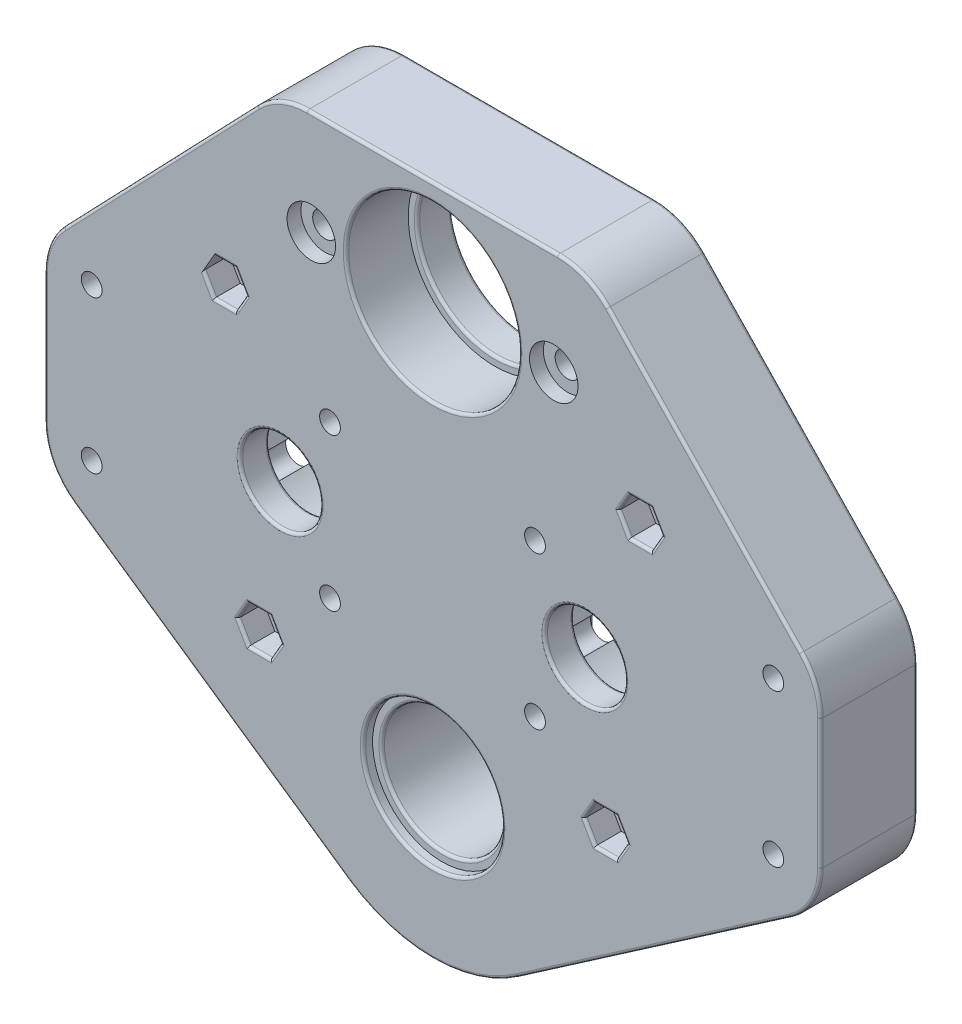
from build123d import *

# Parameters (mm, degrees)
SKETCH1_R                                 = 11.1125
SKETCH1_R_2                               = 7.366
SKETCH1_R_3                               = 14.2875
MAIN_BODY_DEPTH                           = 17.78
MOTOR_CAVITY_OUTLINE_R                    = 7.366
MOTOR_CAVITY_OUTLINE_R_2                  = 1.143
MOTOR_CAVITY_OUTLINE_R_3                  = 4.445
MOTOR_CAVITY_DEPTH                        = 12.446
MOTOR_CAVITY_2_OUTLINE_R                  = 1.143
MOTOR_CAVITY_2_OUTLINE_R_2                = 4.445
MOTOR_CAVITY_2_DEPTH                      = 2.286
MOTOR_START                               = 12.446
MOTOR_CAVITY_3_OUTLINE_R                  = 1.143
MOTOR_CAVITY_3_OUTLINE_R_2                = 4.445
MOTOR_CAVITY_3_DEPTH                      = 3.048
MOTOR_START_2                             = 14.478
MOTOR_CAVITY_4_OUTLINE_R                  = 1.905
MOTOR_CAVITY_4_DEPTH                      = 3.302
MOTOR_START_3                             = 2.286
MOTOR_CAVITY_5_DEPTH                      = 1.778
MOTOR_CAVITY_6_OUTLINE_R                  = 2.286
MOTOR_CAVITY_6_DEPTH                      = 1.27
MOTOR_START_4                             = 15.494
MOTOR_CAVITY_7_DEPTH                      = 0.254
FILLET2_R                                 = 12.7
SKETCH10_R                                = 12.7635
HS_AXLE_BEARING_FLANGE_DEPTH              = 1.778
SKETCH11_R                                = 15.875
BALL_SHIFTER_BEARING_FLANGE_DEPTH         = 11.43
BEARING_FILLET_R                          = 0.508
SKETCH14_R                                = 2.286
GEARBOX_CONNECTION_HOLES_DEPTH            = 133.703818668
POST_HEX_DEPTH                            = 4.826
SKETCH16_R                                = 4.445
GEARBOX_CONNECTION_BOLT_COUNTERBORE_DEPTH = 2.54
SKETCH17_R                                = 2.286
PISTON_MOUNT_HOLES_DEPTH                  = 133.703818668
SKETCH18_R                                = 4.445
PISTON_MOUNT_BOLT_COUNTERBORE_DEPTH       = 2.54
CUT_EXTRUDE2_DEPTH                        = 7.14502
SKETCH21_W                                = 56.72351851
SKETCH21_H                                = 14.605
CUT_EXTRUDE1_DEPTH                        = 133.703818668
FILLET4_R                                 = 0.508
FILLET5_R                                 = 12.7


# Read off the part's stored shape, not the designer's step: Motor Cavity
with BuildPart() as part:
    # Sketch1 → Main Body (new body)
    with BuildSketch(Plane.XY):
        with BuildLine():
            Line((-15.500729017, -22.478665996), (-71.12, 15.875))
            Line((-71.12, 15.875), (-71.12, 51.435))
            Line((-71.12, 51.435), (-24.288000098, 100.259040074))
            ThreePointArc((-24.288000098, 100.259040074), (0, 110.617), (24.288000098, 100.259040074))
            Line((24.288000098, 100.259040074), (71.12, 51.435))
            Line((71.12, 51.435), (71.12, 15.875))
            Line((71.12, 15.875), (15.500729017, -22.478665996))
            ThreePointArc((15.500729017, -22.478665996), (0, -27.305), (-15.500729017, -22.478665996))
        make_face()
        Circle(SKETCH1_R, mode=Mode.SUBTRACT)
        with Locations((-27.94, 34.571070276)):
            Circle(SKETCH1_R_2, mode=Mode.SUBTRACT)
        with Locations(Location((27.94, 34.571070276, 0), (0, 0, 180))):
            Circle(SKETCH1_R_2, mode=Mode.SUBTRACT)
        with Locations((0, 76.962)):
            Circle(SKETCH1_R_3, mode=Mode.SUBTRACT)
    extrude(amount=MAIN_BODY_DEPTH)

    # Motor Cavity outline → Motor Cavity (cut)
    # profile 1 of 12: a face of its own
    with BuildSketch(Plane.XY):
        with BuildLine():
            ThreePointArc((15.229811482, 41.234576022), (13.589, 34.571070275), (15.229811482, 27.907564529))
            ThreePointArc((15.229811482, 27.907564529), (13.900894786, 24.334222724), (17.709432496, 24.506941423))
            ThreePointArc((17.709432496, 24.506941423), (27.94, 20.220070276), (38.170567504, 24.506941423))
            ThreePointArc((38.170567504, 24.506941423), (41.979105214, 24.334222724), (40.650188518, 27.907564529))
            ThreePointArc((40.650188518, 27.907564529), (42.291, 34.571070275), (40.650188518, 41.234576022))
            ThreePointArc((40.650188518, 41.234576022), (41.979105214, 44.807917828), (38.170567504, 44.635199128))
            ThreePointArc((38.170567504, 44.635199128), (27.94, 48.922070276), (17.709432496, 44.635199128))
            ThreePointArc((17.709432496, 44.635199128), (13.900894786, 44.807917828), (15.229811482, 41.234576022))
        make_face()
        with Locations((27.94, 34.571070276)):
            Circle(MOTOR_CAVITY_OUTLINE_R, mode=Mode.SUBTRACT)
    # profile 2 of 12: a face of its own
    with BuildSketch(Plane.XY):
        with Locations((18.796, 48.541070276)):
            Circle(MOTOR_CAVITY_OUTLINE_R_2)
    # profile 3 of 12: a face of its own
    with BuildSketch(Plane.XY):
        with Locations((62.484, 48.541070276)):
            Circle(MOTOR_CAVITY_OUTLINE_R_2)
    # profile 4 of 12: a face of its own
    with BuildSketch(Plane.XY):
        with Locations((18.796, 20.601070276)):
            Circle(MOTOR_CAVITY_OUTLINE_R_2)
    # profile 5 of 12: a face of its own
    with BuildSketch(Plane.XY):
        with BuildLine():
            ThreePointArc((-15.229811482, 27.907564529), (-13.589, 34.571070275), (-15.229811482, 41.234576022))
            ThreePointArc((-15.229811482, 41.234576022), (-13.900894786, 44.807917828), (-17.709432496, 44.635199128))
            ThreePointArc((-17.709432496, 44.635199128), (-27.94, 48.922070276), (-38.170567504, 44.635199128))
            ThreePointArc((-38.170567504, 44.635199128), (-41.979105214, 44.807917828), (-40.650188518, 41.234576023))
            ThreePointArc((-40.650188518, 41.234576023), (-42.291, 34.571070275), (-40.650188518, 27.907564529))
            ThreePointArc((-40.650188518, 27.907564529), (-41.979105214, 24.334222724), (-38.170567504, 24.506941423))
            ThreePointArc((-38.170567504, 24.506941423), (-27.94, 20.220070276), (-17.709432496, 24.506941423))
            ThreePointArc((-17.709432496, 24.506941423), (-13.900894786, 24.334222724), (-15.229811482, 27.907564529))
        make_face()
        with Locations((-27.94, 34.571070276)):
            Circle(MOTOR_CAVITY_OUTLINE_R, mode=Mode.SUBTRACT)
    # profile 6 of 12: a face of its own
    with BuildSketch(Plane.XY):
        with Locations((53.34, 34.571070276)):
            Circle(MOTOR_CAVITY_OUTLINE_R_3)
    # profile 7 of 12: a face of its own
    with BuildSketch(Plane.XY):
        with Locations((-18.796, 48.541070276)):
            Circle(MOTOR_CAVITY_OUTLINE_R_2)
    # profile 8 of 12: a face of its own
    with BuildSketch(Plane.XY):
        with Locations((-18.796, 20.601070276)):
            Circle(MOTOR_CAVITY_OUTLINE_R_2)
    # profile 9 of 12: a face of its own
    with BuildSketch(Plane.XY):
        with Locations((62.484, 20.601070276)):
            Circle(MOTOR_CAVITY_OUTLINE_R_2)
    # profile 10 of 12: a face of its own
    with BuildSketch(Plane.XY):
        with Locations((-62.484, 48.541070276)):
            Circle(MOTOR_CAVITY_OUTLINE_R_2)
    # profile 11 of 12: a face of its own
    with BuildSketch(Plane.XY):
        with Locations((-62.484, 20.601070276)):
            Circle(MOTOR_CAVITY_OUTLINE_R_2)
    # profile 12 of 12: a face of its own
    with BuildSketch(Plane.XY):
        with Locations((-53.34, 34.571070276)):
            Circle(MOTOR_CAVITY_OUTLINE_R_3)
    extrude(amount=MOTOR_CAVITY_DEPTH, mode=Mode.SUBTRACT)

    # Motor Cavity 2 outline → Motor Cavity 2 (cut)
    # profile 1 of 2: a face of its own
    with BuildSketch(Plane.XY):
        with BuildLine():
            ThreePointArc((14.986, 51.398570276), (12.471528286, 50.35704199), (11.43, 47.842570276))
            Line((11.43, 47.842570276), (11.43, 21.299570276))
            ThreePointArc((11.43, 21.299570276), (12.471528286, 18.785098562), (14.986, 17.743570276))
            Line((14.986, 17.743570276), (66.294, 17.743570276))
            ThreePointArc((66.294, 17.743570276), (68.808471714, 18.785098562), (69.85, 21.299570276))
            Line((69.85, 21.299570276), (69.85, 47.842570276))
            ThreePointArc((69.85, 47.842570276), (68.808471713, 50.35704199), (66.294, 51.398570276))
            Line((66.294, 51.398570276), (14.986, 51.398570276))
        make_face()
        with BuildLine():
            ThreePointArc((17.709432496, 44.635199128), (27.94, 48.922070276), (38.170567504, 44.635199128))
            ThreePointArc((38.170567504, 44.635199128), (41.979105214, 44.807917828), (40.650188518, 41.234576023))
            ThreePointArc((40.650188518, 41.234576023), (42.291, 34.571070275), (40.650188518, 27.907564529))
            ThreePointArc((40.650188518, 27.907564529), (41.979105214, 24.334222724), (38.170567504, 24.506941423))
            ThreePointArc((38.170567504, 24.506941423), (27.94, 20.220070276), (17.709432496, 24.506941423))
            ThreePointArc((17.709432496, 24.506941423), (13.900894786, 24.334222724), (15.229811482, 27.907564529))
            ThreePointArc((15.229811482, 27.907564529), (13.589, 34.571070275), (15.229811482, 41.234576022))
            ThreePointArc((15.229811482, 41.234576022), (13.900894786, 44.807917828), (17.709432496, 44.635199128))
        make_face(mode=Mode.SUBTRACT)
        with Locations((18.796, 48.541070276)):
            Circle(MOTOR_CAVITY_2_OUTLINE_R, mode=Mode.SUBTRACT)
        with Locations((62.484, 48.541070276)):
            Circle(MOTOR_CAVITY_2_OUTLINE_R, mode=Mode.SUBTRACT)
        with Locations((53.34, 34.571070276)):
            Circle(MOTOR_CAVITY_2_OUTLINE_R_2, mode=Mode.SUBTRACT)
        with Locations((18.796, 20.601070276)):
            Circle(MOTOR_CAVITY_2_OUTLINE_R, mode=Mode.SUBTRACT)
        with Locations((62.484, 20.601070276)):
            Circle(MOTOR_CAVITY_2_OUTLINE_R, mode=Mode.SUBTRACT)
    # profile 2 of 2: a face of its own
    with BuildSketch(Plane.XY):
        with BuildLine():
            ThreePointArc((-11.43, 47.842570276), (-12.471528286, 50.357041989), (-14.986, 51.398570276))
            Line((-14.986, 51.398570276), (-66.294, 51.398570276))
            ThreePointArc((-66.294, 51.398570276), (-68.808471713, 50.35704199), (-69.85, 47.842570276))
            Line((-69.85, 47.842570276), (-69.85, 21.299570276))
            ThreePointArc((-69.85, 21.299570276), (-68.808471714, 18.785098562), (-66.294, 17.743570276))
            Line((-66.294, 17.743570276), (-14.986, 17.743570276))
            ThreePointArc((-14.986, 17.743570276), (-12.471528286, 18.785098562), (-11.43, 21.299570276))
            Line((-11.43, 21.299570276), (-11.43, 47.842570276))
        make_face()
        with BuildLine():
            ThreePointArc((-15.229811482, 27.907564529), (-13.900894786, 24.334222724), (-17.709432496, 24.506941423))
            ThreePointArc((-17.709432496, 24.506941423), (-27.94, 20.220070276), (-38.170567504, 24.506941423))
            ThreePointArc((-38.170567504, 24.506941423), (-41.979105214, 24.334222724), (-40.650188518, 27.907564529))
            ThreePointArc((-40.650188518, 27.907564529), (-42.291, 34.571070275), (-40.650188518, 41.234576022))
            ThreePointArc((-40.650188518, 41.234576022), (-41.979105214, 44.807917828), (-38.170567504, 44.635199128))
            ThreePointArc((-38.170567504, 44.635199128), (-27.94, 48.922070276), (-17.709432496, 44.635199128))
            ThreePointArc((-17.709432496, 44.635199128), (-13.900894786, 44.807917828), (-15.229811482, 41.234576023))
            ThreePointArc((-15.229811482, 41.234576023), (-13.589, 34.571070275), (-15.229811482, 27.907564529))
        make_face(mode=Mode.SUBTRACT)
        with Locations((-18.796, 20.601070276)):
            Circle(MOTOR_CAVITY_2_OUTLINE_R, mode=Mode.SUBTRACT)
        with Locations((-18.796, 48.541070276)):
            Circle(MOTOR_CAVITY_2_OUTLINE_R, mode=Mode.SUBTRACT)
        with Locations((-62.484, 20.601070276)):
            Circle(MOTOR_CAVITY_2_OUTLINE_R, mode=Mode.SUBTRACT)
        with Locations((-53.34, 34.571070276)):
            Circle(MOTOR_CAVITY_2_OUTLINE_R_2, mode=Mode.SUBTRACT)
        with Locations((-62.484, 48.541070276)):
            Circle(MOTOR_CAVITY_2_OUTLINE_R, mode=Mode.SUBTRACT)
    extrude(amount=MOTOR_CAVITY_2_DEPTH, mode=Mode.SUBTRACT)

    # Motor Cavity 3 outline → Motor Cavity 3 (cut)
    with BuildSketch(Plane.XY.offset(MOTOR_START)):
        with Locations((18.796, 48.541070276)):
            Circle(MOTOR_CAVITY_3_OUTLINE_R)
        with Locations((62.484, 48.541070276)):
            Circle(MOTOR_CAVITY_3_OUTLINE_R)
        with BuildLine():
            ThreePointArc((41.826815, 30.950632435), (42.291, 34.571070275), (41.826815, 38.191508116))
            ThreePointArc((41.826815, 38.191508116), (36.83, 34.571070275), (41.826815, 30.950632435))
        make_face()
        with Locations((18.796, 20.601070276)):
            Circle(MOTOR_CAVITY_3_OUTLINE_R)
        with Locations((53.34, 34.571070276)):
            Circle(MOTOR_CAVITY_3_OUTLINE_R_2)
        with Locations((-18.796, 48.541070276)):
            Circle(MOTOR_CAVITY_3_OUTLINE_R)
        with Locations((-18.796, 20.601070276)):
            Circle(MOTOR_CAVITY_3_OUTLINE_R)
        with Locations((62.484, 20.601070276)):
            Circle(MOTOR_CAVITY_3_OUTLINE_R)
        with Locations((-62.484, 48.541070276)):
            Circle(MOTOR_CAVITY_3_OUTLINE_R)
        with Locations((-62.484, 20.601070276)):
            Circle(MOTOR_CAVITY_3_OUTLINE_R)
        with BuildLine():
            ThreePointArc((-41.826815, 30.950632435), (-36.83, 34.571070275), (-41.826815, 38.191508116))
            ThreePointArc((-41.826815, 38.191508116), (-42.291, 34.571070275), (-41.826815, 30.950632435))
        make_face()
        with Locations((-53.34, 34.571070276)):
            Circle(MOTOR_CAVITY_3_OUTLINE_R_2)
    extrude(amount=MOTOR_CAVITY_3_DEPTH, mode=Mode.SUBTRACT)

    # Motor Cavity 4 outline → Motor Cavity 4 (cut)
    with BuildSketch(Plane.XY.offset(MOTOR_START_2)):
        with Locations((18.796, 48.541070276)):
            Circle(MOTOR_CAVITY_4_OUTLINE_R)
        with Locations((62.484, 48.541070276)):
            Circle(MOTOR_CAVITY_4_OUTLINE_R)
        with Locations((18.796, 20.601070276)):
            Circle(MOTOR_CAVITY_4_OUTLINE_R)
        with Locations((-18.796, 48.541070276)):
            Circle(MOTOR_CAVITY_4_OUTLINE_R)
        with Locations((-18.796, 20.601070276)):
            Circle(MOTOR_CAVITY_4_OUTLINE_R)
        with Locations((62.484, 20.601070276)):
            Circle(MOTOR_CAVITY_4_OUTLINE_R)
        with Locations((-62.484, 48.541070276)):
            Circle(MOTOR_CAVITY_4_OUTLINE_R)
        with Locations((-62.484, 20.601070276)):
            Circle(MOTOR_CAVITY_4_OUTLINE_R)
    extrude(amount=MOTOR_CAVITY_4_DEPTH, mode=Mode.SUBTRACT)

    # Motor Cavity 5 outline → Motor Cavity 5 (cut)
    with BuildSketch(Plane.XY.offset(MOTOR_START_3)):
        with BuildLine():
            Line((52.329058675, 38.899583027), (54.238725974, 40.840832041))
            ThreePointArc((54.238725974, 40.840832041), (50.847666793, 39.152113898), (49.021648336, 35.832971248))
            Line((49.021648336, 35.832971248), (49.072941907, 35.816156713))
            ThreePointArc((49.072941907, 35.816156713), (50.283662499, 37.798581094), (52.329058675, 38.899583027))
        make_face()
        with BuildLine():
            ThreePointArc((61.007669642, 37.238304535), (58.228349782, 40.176614324), (54.238725974, 40.840832041))
            Line((54.238725974, 40.840832041), (52.329058675, 38.899583027))
            ThreePointArc((52.329058675, 38.899583027), (55.454880605, 38.480712846), (57.516068943, 36.093723613))
            Line((57.516068943, 36.093723613), (61.007669642, 37.238304535))
        make_face()
        with BuildLine():
            ThreePointArc((61.595, 34.571070276), (61.446429361, 35.936637516), (61.007669642, 37.238304535))
            Line((61.007669642, 37.238304535), (57.516068943, 36.093723613))
            ThreePointArc((57.516068943, 36.093723613), (57.717250932, 35.344180407), (57.785, 34.571070276))
            ThreePointArc((57.785, 34.571070276), (57.717250932, 33.797960145), (57.516068943, 33.048416938))
            Line((57.516068943, 33.048416938), (61.007669642, 31.903836016))
            ThreePointArc((61.007669642, 31.903836016), (61.44642936, 33.205503036), (61.595, 34.571070276))
        make_face()
        with BuildLine():
            Line((49.072941907, 35.816156713), (49.021648336, 35.832971248))
            ThreePointArc((49.021648336, 35.832971248), (48.988043509, 35.654119431), (48.959577581, 35.474378096))
            Line((48.959577581, 35.474378096), (48.995488935, 35.510883345))
            ThreePointArc((48.995488935, 35.510883345), (49.031510845, 35.664206225), (49.072941907, 35.816156713))
        make_face()
        with BuildLine():
            ThreePointArc((54.238725966, 28.301308513), (58.228349778, 28.965526226), (61.007669642, 31.903836016))
            Line((61.007669642, 31.903836016), (57.516068943, 33.048416938))
            ThreePointArc((57.516068943, 33.048416938), (55.454880601, 30.661427704), (52.329058668, 30.242557527))
            Line((52.329058668, 30.242557527), (54.238725966, 28.301308513))
        make_face()
        with BuildLine():
            Line((48.995488935, 35.510883345), (48.959577581, 35.474378096))
            ThreePointArc((48.959577581, 35.474378096), (48.911164971, 35.02387688), (48.895, 34.571070276))
            ThreePointArc((48.895, 34.571070276), (48.920193631, 35.043655356), (48.995488935, 35.510883345))
        make_face()
        with BuildLine():
            Line((48.995488936, 33.631257201), (48.959577582, 33.66776245))
            ThreePointArc((48.959577582, 33.66776245), (48.98804351, 33.488021117), (49.021648336, 33.309169303))
            Line((49.021648336, 33.309169303), (49.072941908, 33.325983838))
            ThreePointArc((49.072941908, 33.325983838), (49.031510846, 33.477934323), (48.995488936, 33.631257201))
        make_face()
        with BuildLine():
            ThreePointArc((48.895, 34.571070276), (48.911164971, 34.118263669), (48.959577582, 33.66776245))
            Line((48.959577582, 33.66776245), (48.995488936, 33.631257201))
            ThreePointArc((48.995488936, 33.631257201), (48.920193631, 34.098485193), (48.895, 34.571070276))
        make_face()
        with BuildLine():
            ThreePointArc((49.021648336, 33.309169303), (50.84766679, 29.990026656), (54.238725966, 28.301308513))
            Line((54.238725966, 28.301308513), (52.329058668, 30.242557527))
            ThreePointArc((52.329058668, 30.242557527), (50.283662496, 31.343559461), (49.072941908, 33.325983838))
            Line((49.072941908, 33.325983838), (49.021648336, 33.309169303))
        make_face()
        with BuildLine():
            Line((-52.329058675, 38.899583027), (-54.238725974, 40.840832041))
            ThreePointArc((-54.238725974, 40.840832041), (-58.228349782, 40.176614324), (-61.007669642, 37.238304535))
            Line((-61.007669642, 37.238304535), (-57.516068943, 36.093723613))
            ThreePointArc((-57.516068943, 36.093723613), (-55.454880605, 38.480712846), (-52.329058675, 38.899583027))
        make_face()
        with BuildLine():
            ThreePointArc((-49.021648336, 35.832971248), (-50.847666793, 39.152113898), (-54.238725974, 40.840832041))
            Line((-54.238725974, 40.840832041), (-52.329058675, 38.899583027))
            ThreePointArc((-52.329058675, 38.899583027), (-50.283662499, 37.798581094), (-49.072941907, 35.816156713))
            Line((-49.072941907, 35.816156713), (-49.021648336, 35.832971248))
        make_face()
        with BuildLine():
            ThreePointArc((-48.959577581, 35.474378096), (-48.988043509, 35.654119431), (-49.021648336, 35.832971248))
            Line((-49.021648336, 35.832971248), (-49.072941907, 35.816156713))
            ThreePointArc((-49.072941907, 35.816156713), (-49.031510845, 35.664206225), (-48.995488935, 35.510883345))
            Line((-48.995488935, 35.510883345), (-48.959577581, 35.474378096))
        make_face()
        with BuildLine():
            Line((-57.516068943, 36.093723613), (-61.007669642, 37.238304535))
            ThreePointArc((-61.007669642, 37.238304535), (-61.595, 34.571070276), (-61.007669642, 31.903836016))
            Line((-61.007669642, 31.903836016), (-57.516068943, 33.048416938))
            ThreePointArc((-57.516068943, 33.048416938), (-57.785, 34.571070276), (-57.516068943, 36.093723613))
        make_face()
        with BuildLine():
            Line((-52.329058668, 30.242557527), (-54.238725966, 28.301308513))
            ThreePointArc((-54.238725966, 28.301308513), (-50.84766679, 29.990026656), (-49.021648336, 33.309169303))
            Line((-49.021648336, 33.309169303), (-49.072941908, 33.325983838))
            ThreePointArc((-49.072941908, 33.325983838), (-50.283662496, 31.343559461), (-52.329058668, 30.242557527))
        make_face()
        with BuildLine():
            ThreePointArc((-61.007669642, 31.903836016), (-58.228349778, 28.965526226), (-54.238725966, 28.301308513))
            Line((-54.238725966, 28.301308513), (-52.329058668, 30.242557527))
            ThreePointArc((-52.329058668, 30.242557527), (-55.454880601, 30.661427704), (-57.516068943, 33.048416938))
            Line((-57.516068943, 33.048416938), (-61.007669642, 31.903836016))
        make_face()
        with BuildLine():
            Line((-49.072941908, 33.325983838), (-49.021648336, 33.309169303))
            ThreePointArc((-49.021648336, 33.309169303), (-48.98804351, 33.488021117), (-48.959577582, 33.66776245))
            Line((-48.959577582, 33.66776245), (-48.995488936, 33.631257201))
            ThreePointArc((-48.995488936, 33.631257201), (-49.031510846, 33.477934323), (-49.072941908, 33.325983838))
        make_face()
        with BuildLine():
            ThreePointArc((-48.895, 34.571070276), (-48.911164971, 35.02387688), (-48.959577581, 35.474378096))
            Line((-48.959577581, 35.474378096), (-48.995488935, 35.510883345))
            ThreePointArc((-48.995488935, 35.510883345), (-48.920193631, 35.043655356), (-48.895, 34.571070276))
        make_face()
        with BuildLine():
            Line((-48.995488936, 33.631257201), (-48.959577582, 33.66776245))
            ThreePointArc((-48.959577582, 33.66776245), (-48.911164971, 34.118263669), (-48.895, 34.571070276))
            ThreePointArc((-48.895, 34.571070276), (-48.920193631, 34.098485193), (-48.995488936, 33.631257201))
        make_face()
    extrude(amount=MOTOR_CAVITY_5_DEPTH, mode=Mode.SUBTRACT)

    # Motor Cavity 6 outline → Motor Cavity 6 (cut)
    with BuildSketch(Plane.XY.offset(MOTOR_START)):
        with Locations((15.748, 43.461070276)):
            Circle(MOTOR_CAVITY_6_OUTLINE_R)
        with Locations((40.132, 43.461070276)):
            Circle(MOTOR_CAVITY_6_OUTLINE_R)
        with Locations((15.748, 25.681070276)):
            Circle(MOTOR_CAVITY_6_OUTLINE_R)
        with Locations((40.132, 25.681070276)):
            Circle(MOTOR_CAVITY_6_OUTLINE_R)
        with Locations((-15.748, 25.681070276)):
            Circle(MOTOR_CAVITY_6_OUTLINE_R)
        with Locations((-15.748, 43.461070276)):
            Circle(MOTOR_CAVITY_6_OUTLINE_R)
        with Locations((-40.132, 43.461070276)):
            Circle(MOTOR_CAVITY_6_OUTLINE_R)
        with Locations((-40.132, 25.681070276)):
            Circle(MOTOR_CAVITY_6_OUTLINE_R)
    extrude(amount=MOTOR_CAVITY_6_DEPTH, mode=Mode.SUBTRACT)

    # Motor Cavity 7 outline → Motor Cavity 7 (cut)
    with BuildSketch(Plane.XY.offset(MOTOR_START_4)):
        with BuildLine():
            ThreePointArc((41.826815, 30.950632435), (42.291, 34.571070275), (41.826815, 38.191508116))
            ThreePointArc((41.826815, 38.191508116), (36.83, 34.571070275), (41.826815, 30.950632435))
        make_face()
        with BuildLine():
            ThreePointArc((-41.826815, 30.950632435), (-36.83, 34.571070275), (-41.826815, 38.191508116))
            ThreePointArc((-41.826815, 38.191508116), (-42.291, 34.571070275), (-41.826815, 30.950632435))
        make_face()
    extrude(amount=MOTOR_CAVITY_7_DEPTH, mode=Mode.SUBTRACT)

    # Fillet2
    fillet2_edges = [part.edges().sort_by_distance(p)[0] for p in [
        (-71.12, 15.875, 8.89),
        (-71.12, 51.435, 8.89),
        (71.12, 51.435, 8.89),
        (71.12, 15.875, 8.89),
    ]]
    fillet(fillet2_edges, radius=FILLET2_R)

    # Sketch10 → HS Axle Bearing Flange (cut)
    with BuildSketch(Plane.XY.offset(17.78)):
        Circle(SKETCH10_R)
    extrude(amount=-HS_AXLE_BEARING_FLANGE_DEPTH, mode=Mode.SUBTRACT)

    # Sketch11 → Ball Shifter Bearing Flange (cut)
    with BuildSketch(Plane.XY.offset(17.78)):
        with Locations((0, 76.962)):
            Circle(SKETCH11_R)
    extrude(amount=-BALL_SHIFTER_BEARING_FLANGE_DEPTH, mode=Mode.SUBTRACT)

    # Bearing Fillet
    bearing_fillet_edges = [part.edges().sort_by_distance(p)[0] for p in [
        (-11.1125, 0, 0),
        (-14.2875, 76.962, 0),
        (-11.1125, 0, 16.002),
        (-12.7635, 0, 17.78),
        (-15.875, 76.962, 17.78),
        (-14.2875, 76.962, 6.35),
    ]]
    fillet(bearing_fillet_edges, radius=BEARING_FILLET_R)

    # Sketch14 → Gearbox Connection Holes (cut, through all)
    with BuildSketch(Plane.XY.offset(17.78)):
        with Locations((-38.1, 60.96)):
            Circle(SKETCH14_R)
        with Locations((-31.75, 8.89)):
            Circle(SKETCH14_R)
        with Locations(Location((38.1, 60.96, 0), (0, 0, 180))):
            Circle(SKETCH14_R)
        with Locations(Location((31.75, 8.89, 0), (0, 0, 180))):
            Circle(SKETCH14_R)
    extrude(amount=-GEARBOX_CONNECTION_HOLES_DEPTH, mode=Mode.SUBTRACT)

    # Sketch15 → Post Hex (cut)
    with BuildSketch(Plane.XY.offset(17.78)):
        Polygon((-34.140531854, 60.96), (-36.120265927, 64.389), (-40.079734073, 64.389), (-42.059468146, 60.96), (-40.079734073, 57.531), (-36.120265927, 57.531), align=None)
        Polygon((-27.790531854, 8.89), (-29.770265927, 12.319), (-33.729734073, 12.319), (-35.709468146, 8.89), (-33.729734073, 5.461), (-29.770265927, 5.461), align=None)
        Polygon((29.770265927, 5.461), (27.790531854, 8.89), (29.770265927, 12.319), (33.729734073, 12.319), (35.709468146, 8.89), (33.729734073, 5.461), align=None)
        Polygon((36.120265927, 57.531), (34.140531854, 60.96), (36.120265927, 64.389), (40.079734073, 64.389), (42.059468146, 60.96), (40.079734073, 57.531), align=None)
    extrude(amount=-POST_HEX_DEPTH, mode=Mode.SUBTRACT)

    # Sketch16 → Gearbox Connection Bolt Counterbore (cut)
    with BuildSketch(Plane(origin=(0, 0, 0), x_dir=(-1, 0, 0), z_dir=(0, 0, -1))):
        with Locations((-38.1, 60.96)):
            Circle(SKETCH16_R)
        with Locations((-31.75, 8.89)):
            Circle(SKETCH16_R)
        with Locations((38.1, 60.96)):
            Circle(SKETCH16_R)
        with Locations((31.75, 8.89)):
            Circle(SKETCH16_R)
    extrude(amount=-GEARBOX_CONNECTION_BOLT_COUNTERBORE_DEPTH, mode=Mode.SUBTRACT)

    # Sketch17 → Piston Mount Holes (cut, through all)
    with BuildSketch(Plane.XY.offset(17.78)):
        with Locations((-22.225, 76.962)):
            Circle(SKETCH17_R)
        with Locations(Location((22.225, 76.962, 0), (0, 0, 180))):
            Circle(SKETCH17_R)
    extrude(amount=-PISTON_MOUNT_HOLES_DEPTH, mode=Mode.SUBTRACT)

    # Sketch18 → Piston Mount Bolt Counterbore (cut)
    with BuildSketch(Plane.XY.offset(17.78)):
        with Locations((-22.225, 76.962)):
            Circle(SKETCH18_R)
        with Locations((22.225, 76.962)):
            Circle(SKETCH18_R)
    extrude(amount=-PISTON_MOUNT_BOLT_COUNTERBORE_DEPTH, mode=Mode.SUBTRACT)

    # Sketch22 → Cut-Extrude2 (cut)
    with BuildSketch(Plane(origin=(0, 0, 0), x_dir=(-1, 0, 0), z_dir=(0, 0, -1))):
        Polygon((-18.265531854, 76.962), (-20.245265927, 80.391), (-24.204734073, 80.391), (-26.184468146, 76.962), (-24.204734073, 73.533), (-20.245265927, 73.533), align=None)
        Polygon((26.184468146, 76.962), (24.204734073, 80.391), (20.245265927, 80.391), (18.265531854, 76.962), (20.245265927, 73.533), (24.204734073, 73.533), align=None)
    extrude(amount=-CUT_EXTRUDE2_DEPTH, mode=Mode.SUBTRACT)

    # Sketch21 → Cut-Extrude1 (cut, through all)
    with BuildSketch(Plane(origin=(0, 0, 0), x_dir=(-1, 0, 0), z_dir=(0, 0, -1))):
        with Locations((0, 103.3145)):
            Rectangle(SKETCH21_W, SKETCH21_H)
    extrude(amount=-CUT_EXTRUDE1_DEPTH, mode=Mode.SUBTRACT)

    # Fillet4
    fillet4_edges = [part.edges().sort_by_distance(p)[0] for p in [
        (40.56518521, -5.194840368, 0),
        (0, -27.305, 0),
        (-35.306, 34.571070276, 12.446),
        (-35.306, 34.571070276, 17.78),
        (35.306, 34.571070276, 17.78),
        (47.973521156, 75.566034614, 0),
        (47.973521156, 75.566034614, 17.78),
        (-40.56518521, -5.194840368, 0),
        (-71.12, 34.436456048, 0),
        (71.12, 34.436456048, 0),
        (-70.20323162, 51.066396551, 0),
        (-69.663941609, 16.639623124, 0),
        (69.663941609, 16.639623124, 0),
        (70.20323162, 51.066396551, 0),
        (71.12, 34.436456048, 17.78),
        (-71.12, 34.436456048, 17.78),
        (-40.56518521, -5.194840368, 17.78),
        (-70.20323162, 51.066396551, 17.78),
        (-69.663941609, 16.639623124, 17.78),
        (69.663941609, 16.639623124, 17.78),
        (70.20323162, 51.066396551, 17.78),
        (0, -27.305, 17.78),
        (40.386, 60.96, 12.954),
        (38.1, 57.531, 17.78),
        (41.06960111, 59.2455, 17.78),
        (41.06960111, 62.6745, 17.78),
        (38.1, 64.389, 17.78),
        (35.13039889, 62.6745, 17.78),
        (35.13039889, 59.2455, 17.78),
        (34.036, 8.89, 12.954),
        (31.75, 5.461, 17.78),
        (34.71960111, 7.1755, 17.78),
        (34.71960111, 10.6045, 17.78),
        (31.75, 12.319, 17.78),
        (28.78039889, 10.6045, 17.78),
        (28.78039889, 7.1755, 17.78),
        (-28.78039889, 7.1755, 17.78),
        (-28.78039889, 10.6045, 17.78),
        (-31.75, 12.319, 17.78),
        (-34.71960111, 10.6045, 17.78),
        (-34.71960111, 7.1755, 17.78),
        (-31.75, 5.461, 17.78),
        (-34.036, 8.89, 12.954),
        (-35.13039889, 59.2455, 17.78),
        (-35.13039889, 62.6745, 17.78),
        (-38.1, 64.389, 17.78),
        (-41.06960111, 59.2455, 17.78),
        (-38.1, 57.531, 17.78),
        (-41.06960111, 62.6745, 12.954),
        (-40.386, 60.96, 12.954),
        (36.195, 8.89, 0),
        (34.036, 8.89, 2.54),
        (-33.655, 60.96, 0),
        (-40.386, 60.96, 2.54),
        (-27.305, 8.89, 0),
        (-34.036, 8.89, 2.54),
        (42.545, 60.96, 0),
        (40.386, 60.96, 2.54),
        (35.306, 34.571070276, 12.446),
        (-47.973521156, 75.566034614, 0),
        (-47.973521156, 75.566034614, 17.78),
        (0, 96.012, 0),
        (0, 96.012, 17.78),
        (40.56518521, -5.194840368, 17.78),
    ]]
    fillet(fillet4_edges, radius=FILLET4_R)

    # Fillet5
    # the kernel refuses this fillet: 12.7 mm, written as the material it takes off along each edge
    with BuildSketch(Plane(origin=(22.945665278, 83.312, 0), x_dir=(0, 1, 0), z_dir=(-1, 0, 0))) as fillet5_piece_1:
        with BuildLine():
            CenterArc((12.192, -0.508), 0.508, 0, 90)
            Line((12.7, -0.508), (12.7, 0))
            Line((12.7, 0), (12.192, 0))
        make_face()
    revolve(axis=Axis((22.945665278, 83.312, 0), (0, 0, -1)), revolution_arc=46.193014046, mode=Mode.SUBTRACT)
    with BuildSketch(Plane(origin=(-22.945665278, 83.312, 0), x_dir=(-0.7216758311739806, 0.6922311714299959, 0), z_dir=(-0.6922311714299959, -0.7216758311739806, 0))) as fillet5_piece_2:
        with BuildLine():
            CenterArc((12.192, -0.508), 0.508, 0, 90)
            Line((12.7, -0.508), (12.7, 0))
            Line((12.7, 0), (12.192, 0))
        make_face()
    revolve(axis=Axis((-22.945665278, 83.312, 0), (0, 0, -1)), revolution_arc=46.193014046, mode=Mode.SUBTRACT)
    with BuildSketch(Plane(origin=(-22.945665278, 83.312, 17.78), x_dir=(0, 1, 0), z_dir=(1, 0, 0))) as fillet5_piece_3:
        with BuildLine():
            CenterArc((12.192, -0.508), 0.508, 0, 90)
            Line((12.7, -0.508), (12.7, 0))
            Line((12.7, 0), (12.192, 0))
        make_face()
    revolve(axis=Axis((-22.945665278, 83.312, 17.78), (0, 0, 1)), revolution_arc=46.193014046, mode=Mode.SUBTRACT)
    with BuildSketch(Plane(origin=(22.945665278, 83.312, 17.78), x_dir=(0.7216758311739803, 0.6922311714299964, 0), z_dir=(0.6922311714299964, -0.7216758311739803, 0))) as fillet5_piece_4:
        with BuildLine():
            CenterArc((12.192, -0.508), 0.508, 0, 90)
            Line((12.7, -0.508), (12.7, 0))
            Line((12.7, 0), (12.192, 0))
        make_face()
    revolve(axis=Axis((22.945665278, 83.312, 17.78), (0, 0, 1)), revolution_arc=46.193014046, mode=Mode.SUBTRACT)
    with BuildSketch(Plane(origin=(-28.361759255, 96.012, 0), x_dir=(1, 0, 0), z_dir=(0, 0, 1))) as fillet5_piece_5:
        with BuildLine():
            CenterArc((FILLET5_R * 0.426464092707, -FILLET5_R), FILLET5_R, 90, 46.193014046)
            Line((-FILLET5_R * 0.295211738467, -FILLET5_R * 0.30776882857), (0, 0))
            Line((0, 0), (FILLET5_R * 0.426464092707, 0))
        make_face()
    extrude(amount=17.78, mode=Mode.SUBTRACT)
    with BuildSketch(Plane(origin=(28.361759255, 96.012, 0), x_dir=(-1, 0, 0), z_dir=(0, 0, 1))) as fillet5_piece_6:
        with BuildLine():
            CenterArc((FILLET5_R * 0.426464092707, FILLET5_R), FILLET5_R, 223.806985954, 46.193014046)
            Line((-FILLET5_R * 0.295211738467, FILLET5_R * 0.30776882857), (0, 0))
            Line((0, 0), (FILLET5_R * 0.426464092707, 0))
        make_face()
    extrude(amount=17.78, mode=Mode.SUBTRACT)


solid = part.part
